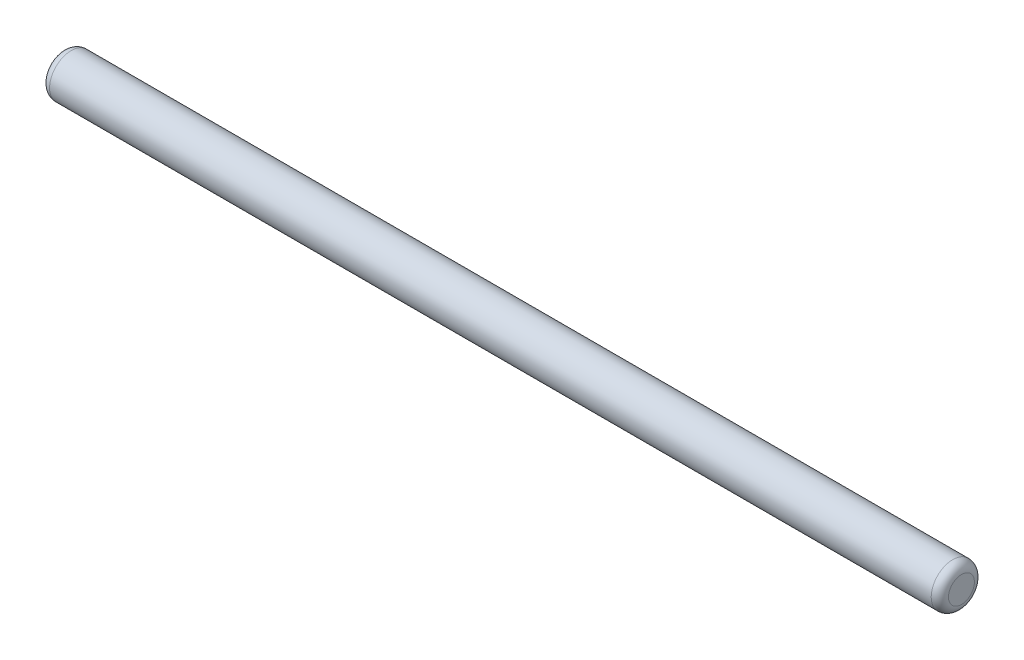
from build123d import *

# Parameters (mm, degrees)
SKETCH1_R           = 2.5
BOSS_EXTRUDE1_DEPTH = 104
FILLET1_R           = 1


with BuildPart() as part:
    # Sketch1 → Boss-Extrude1 (new body)
    with BuildSketch(Plane.YZ):
        Circle(SKETCH1_R)
    extrude(amount=BOSS_EXTRUDE1_DEPTH)

    # Fillet1
    fillet1_edges = [part.edges().sort_by_distance(p)[0] for p in [
        (0, -2.5, 0),
        (104, -2.5, 0),
    ]]
    fillet(fillet1_edges, radius=FILLET1_R)


solid = part.part
